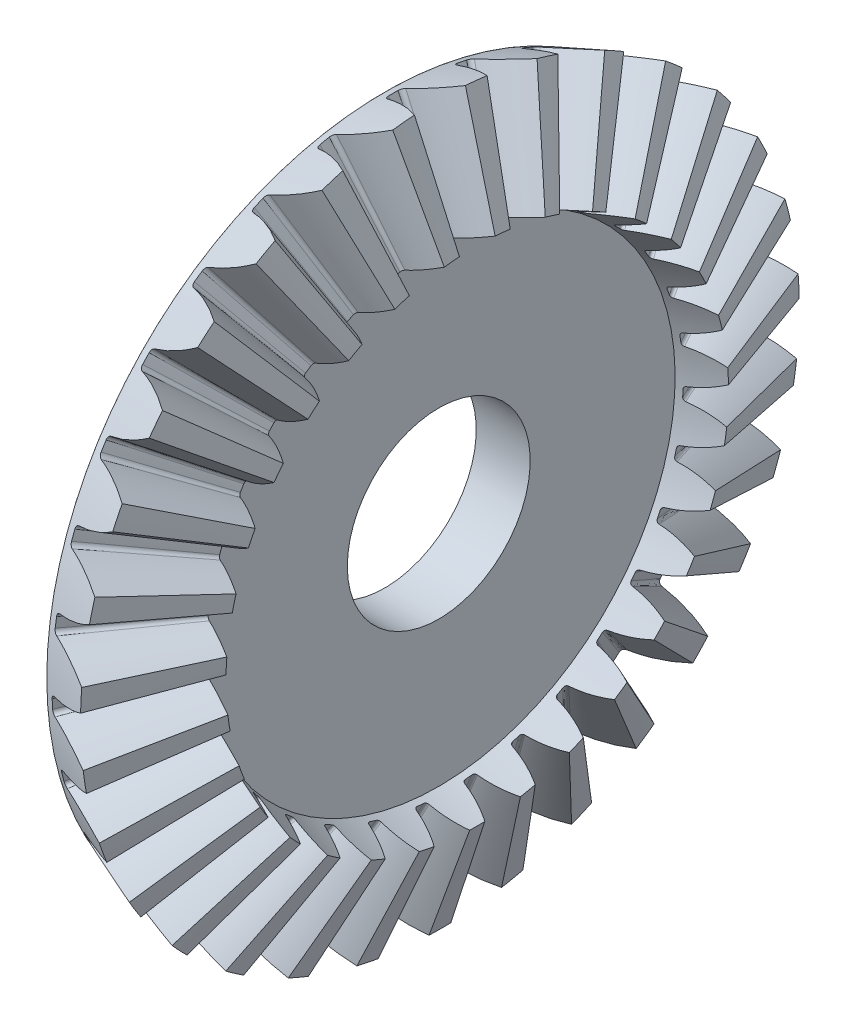
from build123d import *

# Parameters (mm, degrees)
TEETHCUTS_COUNT = 31
HUBSKE_R        = 14.787004248
HUB_DEPTH       = 0.0001016
BORSKE_R        = 4
BORE_DEPTH      = 7.841956492


with BuildPart() as part:
    # BasProSke → Base-Revolve (revolve)
    with BuildSketch(Plane(origin=(0, 0, 0), x_dir=(1, 0, 0), z_dir=(0, 1, 0)), mode=Mode.PRIVATE) as base_revolve_sk:
        Polygon((0, 0), (0, 14.787004251), (2.409772707, 15.719819488), (4.043912677, 10.990851045), (2.359068084, 10.338653141), (2.359068084, 0), align=None)
    revolve(base_revolve_sk.sketch.rotate(Axis((-10, 0, 0), (1, 0, 0)), 180), axis=Axis((-10, 0, 0), (1, 0, 0)))

    # ToothCut: read off the stored shape, not the designer's step
    # ToothCut: loft between two sections, ruled curve by curve
    toothcut_from = [
        Edge.make_bspline([(7.851086709, 0.003553941, -0.008022968), (7.84522452, 0.001284707, -0.015736536), (7.835983395, -0.002292502, -0.014831552), (7.831521219, -0.004019797, -0.006106917)], [0, 0, 0, 0, 1, 1, 1, 1], 3, [1, 0.705739833, 0.705739833, 1]),
        Edge.make_bspline([(7.831521219, -0.004019797, 0.006106917), (7.835983395, -0.002292502, 0.014831552), (7.84522452, 0.001284707, 0.015736536), (7.851086709, 0.003553941, 0.008022968)], [0, 0, 0, 0, 1, 1, 1, 1], 3, [1, 0.705739833, 0.705739833, 1]),
        Edge.make_bspline([(7.831521219, -0.004019797, -0.006106917), (7.831006025, -0.004219226, -0.005099588), (7.830622232, -0.004367791, -0.004026956), (7.830376854, -0.004462776, -0.00290862)], [0, 0, 0, 0, 1, 1, 1, 1], 3, [1, 0.993909128, 0.993909128, 1]),
        Edge.make_bspline([(7.830376854, -0.004462776, 0.00290862), (7.830622232, -0.004367791, 0.004026956), (7.831006025, -0.004219226, 0.005099588), (7.831521219, -0.004019797, 0.006106917)], [0, 0, 0, 0, 1, 1, 1, 1], 3, [1, 0.993909128, 0.993909128, 1]),
        Edge.make_bspline([(7.830376854, -0.004462776, -0.00290862), (7.829955232, -0.004625985, -0.00098703), (7.829955232, -0.004625985, 0.00098703), (7.830376854, -0.004462776, 0.00290862)], [0, 0, 0, 0, 1, 1, 1, 1], 3, [1, 0.982280336, 0.982280336, 1]),
        Edge.make_line((7.851086709, 0.003553941, 0.008022968), (7.851086709, 0.003553941, -0.008022968)),
    ]
    toothcut_to = [
        Edge.make_bspline([(2.662930337, 15.81781599, -1.289983442), (2.007468781, 15.564088937, -0.838736014), (1.281267275, 15.282978678, -0.536676572), (0.513483988, 14.985772245, -0.395933293)], [0, 0, 0, 0, 1, 1, 1, 1], 3, [1, 0.986616126, 0.986616126, 1]),
        Edge.make_bspline([(0.513483988, 14.985772245, 0.395933293), (1.281267275, 15.282978678, 0.536676572), (2.007468781, 15.564088937, 0.838736014), (2.662930337, 15.81781599, 1.289983442)], [0, 0, 0, 0, 1, 1, 1, 1], 3, [1, 0.986616126, 0.986616126, 1]),
        Edge.make_bspline([(0.513483988, 14.985772245, -0.395933293), (0.4237655, 14.951042508, -0.379486889), (0.365595701, 14.928525166, -0.304418321), (0.366948111, 14.92904868, -0.20682763)], [0, 0, 0, 0, 1, 1, 1, 1], 3, [1, 0.839701927, 0.839701927, 1]),
        Edge.make_bspline([(0.366948111, 14.92904868, 0.20682763), (0.365595701, 14.928525166, 0.304418321), (0.4237655, 14.951042508, 0.379486889), (0.513483988, 14.985772245, 0.395933293)], [0, 0, 0, 0, 1, 1, 1, 1], 3, [1, 0.839701927, 0.839701927, 1]),
        Edge.make_bspline([(0.366948111, 14.92904868, -0.20682763), (0.36885885, 14.929788321, -0.068947618), (0.36885885, 14.929788321, 0.068947618), (0.366948111, 14.92904868, 0.20682763)], [0, 0, 0, 0, 1, 1, 1, 1], 3, [1, 0.999926405, 0.999926405, 1]),
        Edge.make_line((2.662930337, 15.81781599, 1.289983442), (2.662930337, 15.81781599, -1.289983442)),
    ]
    toothcut = Solid(Shell([*[Face.make_surface_from_curves(toothcut_from[k], toothcut_to[k]) for k in range(6)], Face(Wire(toothcut_from)), Face(Wire(toothcut_to))]))
    add(toothcut, mode=Mode.SUBTRACT)

    # TeethCuts: ToothCut ×31 about axis
    teethcuts_axis = Axis((-10, 0, 0), (1, 0, 0))
    for i in range(1, TEETHCUTS_COUNT):
        add(toothcut.rotate(teethcuts_axis, i * 360 / TEETHCUTS_COUNT), mode=Mode.SUBTRACT)

    # HubSke → Hub (add)
    with BuildSketch(Plane.ZY):
        Circle(HUBSKE_R)
    extrude(amount=HUB_DEPTH)

    # BorSke → Bore (cut, symmetric)
    with BuildSketch(Plane(origin=(0, 0, 0), x_dir=(0, 0, -1), z_dir=(1, 0, 0))):
        with Locations(Location((0, 0, 0), (0, 0, 180))):
            Circle(BORSKE_R)
    extrude(amount=BORE_DEPTH, both=True, mode=Mode.SUBTRACT)


solid = part.part
